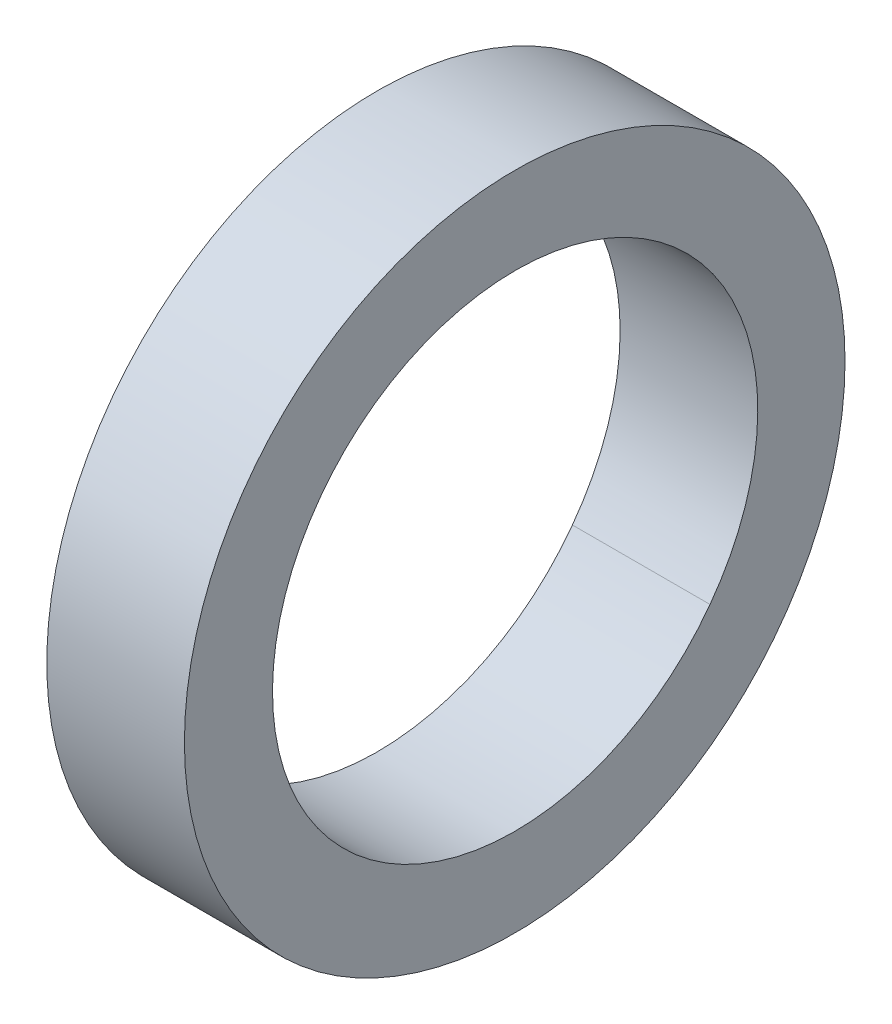
from build123d import *
from build123d.topology import SkipClean

# Parameters (mm, degrees)
SKETCH1_W           = 200
SKETCH1_H           = 200
BOSS_EXTRUDE1_DEPTH = 30
SKETCH4_W           = 175
SKETCH4_H           = 175
CUT_EXTRUDE1_DEPTH  = 30
SKETCH7_R           = 4
CUT_EXTRUDE2_DEPTH  = 210
SKETCH10_W          = 6.040230253
SKETCH10_H          = 30
BOSS_EXTRUDE2_DEPTH = 20
SKETCH11_W          = 10
SKETCH11_H          = 30
BOSS_EXTRUDE3_DEPTH = 20
CUT_EXTRUDE3_START  = -231
SKETCH12_R          = 4
CUT_EXTRUDE3_DEPTH  = 231
SKETCH13_R          = 4
CUT_EXTRUDE5_DEPTH  = 231
SKETCH14_R          = 4
CUT_EXTRUDE6_DEPTH  = 250.5
SKETCH15_R          = 30
SKETCH15_R_2        = 22
BOSS_EXTRUDE5_DEPTH = 201
SKETCH17_R          = 22
CUT_EXTRUDE7_DEPTH  = 201
SKETCH21_W          = 9.5
SKETCH21_H          = 28.855904386
BOSS_EXTRUDE6_DEPTH = 26
SKETCH22_W          = 9.5
SKETCH22_H          = 6.040230253
CUT_EXTRUDE10_DEPTH = 49
SKETCH23_W          = 10.008922512
SKETCH23_H          = 28.855904386
BOSS_EXTRUDE7_DEPTH = 21
SKETCH24_W          = 9.5
SKETCH24_H          = 1.144095614
CUT_EXTRUDE11_DEPTH = 27
SKETCH26_W          = 0.50137975
SKETCH26_H          = 20.893624798
CUT_EXTRUDE12_DEPTH = 35
SKETCH27_R          = 49.192783102
CUT_EXTRUDE13_DEPTH = 175
SKETCH28_R          = 41.209023923
CUT_EXTRUDE14_DEPTH = 175
CUT_EXTRUDE15_START = -220
CUT_EXTRUDE15_DEPTH = 220
SKETCH33_R          = 22
CUT_EXTRUDE16_DEPTH = 220
SKETCH34_W          = 15.88682826
SKETCH34_H          = 39.259510286
CUT_EXTRUDE17_DEPTH = 14
SKETCH35_R          = 61.810225576
CUT_EXTRUDE18_DEPTH = 218


# Read off the part's stored shape, not the designer's step: Cut-Extrude15
with BuildPart() as part:
    # Sketch1 → Boss-Extrude1 (new body)
    with BuildSketch(Plane(origin=(0, 0, 0), x_dir=(1, 0, 0), z_dir=(0, 1, 0))):
        Rectangle(SKETCH1_W, SKETCH1_H)
    extrude(amount=BOSS_EXTRUDE1_DEPTH)

    # Sketch4 → Cut-Extrude1 (cut)
    with BuildSketch(Plane(origin=(0, 30, 0), x_dir=(1, 0, 0), z_dir=(0, 1, 0))):
        Rectangle(SKETCH4_W, SKETCH4_H)
    extrude(amount=-CUT_EXTRUDE1_DEPTH, mode=Mode.SUBTRACT)

    # Sketch7 → Cut-Extrude2 (cut)
    with BuildSketch(Plane.ZY.offset(100)):
        with Locations((0, 15)):
            Circle(SKETCH7_R)
    extrude(amount=-CUT_EXTRUDE2_DEPTH, mode=Mode.SUBTRACT)

    # Sketch10 → Boss-Extrude2 (add)
    with BuildSketch(Plane.ZY.offset(100)):
        with Locations((-11.64671233, 15)):
            Rectangle(SKETCH10_W, SKETCH10_H)
    extrude(amount=BOSS_EXTRUDE2_DEPTH)

    # Sketch11 → Boss-Extrude3 (add)
    with BuildSketch(Plane.XY.offset(-8.626597203)):
        with Locations((-115, 15)):
            Rectangle(SKETCH11_W, SKETCH11_H)
    extrude(amount=BOSS_EXTRUDE3_DEPTH)

    # Sketch12 → Cut-Extrude3 (cut)
    with BuildSketch(Plane(origin=(100, 0, 0), x_dir=(0, 0, -1), z_dir=(1, 0, 0)).offset(CUT_EXTRUDE3_START)):
        with Locations(Location((0, 15, 0), (0, 0, 180))):
            Circle(SKETCH12_R)
    extrude(amount=CUT_EXTRUDE3_DEPTH, mode=Mode.SUBTRACT)

    # Sketch13 → Cut-Extrude5 (cut)
    with BuildSketch(Plane(origin=(0, 30, 0), x_dir=(1, 0, 0), z_dir=(0, 1, 0))):
        with Locations(Location((-93.69452155, -93.045501349, 0), (0, 0, 270))):
            Circle(SKETCH13_R)
    extrude(amount=-CUT_EXTRUDE5_DEPTH, mode=Mode.SUBTRACT)

    # Sketch14 → Cut-Extrude6 (cut)
    with BuildSketch(Plane.XY.offset(100)):
        with Locations((0, 13.614739596)):
            Circle(SKETCH14_R)
    extrude(amount=-CUT_EXTRUDE6_DEPTH, mode=Mode.SUBTRACT)

    # Sketch15 → Boss-Extrude5 (add)
    with BuildSketch(Plane(origin=(100, 0, 0), x_dir=(0, 0, -1), z_dir=(1, 0, 0))):
        with Locations((0, 15)):
            Circle(SKETCH15_R)
        with Locations((0, 15)):
            Circle(SKETCH15_R_2, mode=Mode.SUBTRACT)
    extrude(amount=-BOSS_EXTRUDE5_DEPTH)

    # Sketch17 → Cut-Extrude7 (cut)
    with BuildSketch(Plane(origin=(100, 0, 0), x_dir=(0, 0, -1), z_dir=(1, 0, 0))):
        with Locations((0.074377339, 15.100772812)):
            Circle(SKETCH17_R)
    extrude(amount=-CUT_EXTRUDE7_DEPTH, mode=Mode.SUBTRACT)


with BuildPart() as cut_extrude7_piece_1:
    # of the separate pieces the step leaves, piece 1, a body of its own (cut_extrude7_pieces)
    add(part.part.solids().sort_by_distance((-100, 0, -100))[0])



with BuildPart() as cut_extrude7_piece_2:
    # of the separate pieces the step leaves, piece 2, a body of its own (cut_extrude7_pieces)
    add(part.part.solids().sort_by_distance((-101, 0, -14.666827456))[0])

    # Sketch21 → Boss-Extrude6 (add)
    with BuildSketch(Plane(origin=(0, 0, -14.666827456), x_dir=(-1, 0, 0), z_dir=(0, 0, -1))):
        with Locations((115.25, 15.572047807)):
            Rectangle(SKETCH21_W, SKETCH21_H)
    extrude(amount=BOSS_EXTRUDE6_DEPTH)

    # Sketch22 → Cut-Extrude10 (cut)
    with BuildSketch(Plane(origin=(0, 30, 0), x_dir=(1, 0, 0), z_dir=(0, 1, 0))):
        with Locations((-105.75, 11.64671233)):
            Rectangle(SKETCH22_W, SKETCH22_H)
    extrude(amount=-CUT_EXTRUDE10_DEPTH, mode=Mode.SUBTRACT)


with BuildPart() as cut_extrude7_piece_1_1:
    add(cut_extrude7_piece_1.part)

    add(cut_extrude7_piece_2.part)  # Boss-Extrude7 merges Cut-Extrude7 piece 2
    # Sketch23 → Boss-Extrude7 (add)
    with BuildSketch(Plane(origin=(-110.5, 0, 0), x_dir=(0, 0, -1), z_dir=(1, 0, 0))):
        with Locations((35.6623662, 15.572047807)):
            Rectangle(SKETCH23_W, SKETCH23_H)
    extrude(amount=BOSS_EXTRUDE7_DEPTH)

    # Sketch24 → Cut-Extrude11 (cut)
    with BuildSketch(Plane(origin=(0, 0, -14.666827456), x_dir=(-1, 0, 0), z_dir=(0, 0, -1))):
        with Locations((115.25, 0.572047807)):
            Rectangle(SKETCH24_W, SKETCH24_H)
    extrude(amount=-CUT_EXTRUDE11_DEPTH, mode=Mode.SUBTRACT)

    # Sketch26 → Cut-Extrude12 (cut)
    with BuildSketch(Plane.XZ):
        with Locations((-110.249310125, 1.820215196)):
            Rectangle(SKETCH26_W, SKETCH26_H)
    extrude(amount=-CUT_EXTRUDE12_DEPTH, mode=Mode.SUBTRACT)

    # Sketch27 → Cut-Extrude13 (cut)
    with BuildSketch(Plane(origin=(-87.5, 0, 0), x_dir=(0, 0, -1), z_dir=(1, 0, 0))):
        with Locations((-31.916352411, 15.376133278)):
            Circle(SKETCH27_R)
    extrude(amount=CUT_EXTRUDE13_DEPTH, mode=Mode.SUBTRACT)

    # Sketch28 → Cut-Extrude14 (cut)
    with BuildSketch(Plane(origin=(-87.5, 0, 0), x_dir=(0, 0, -1), z_dir=(1, 0, 0))):
        with Locations((37.762434774, 15.494435184)):
            Circle(SKETCH28_R)
    extrude(amount=CUT_EXTRUDE14_DEPTH, mode=Mode.SUBTRACT)

    # Cut-Extrude15 outline → Cut-Extrude15 (cut)
    with SkipClean():  # the faces are left unmerged after this step: merging them gives an invalid solid
        with BuildSketch(Plane(origin=(100, 0, 0), x_dir=(0, 0, -1), z_dir=(1, 0, 0)).offset(CUT_EXTRUDE15_START)):
            with BuildLine():
                ThreePointArc((25.980762114, 30), (30, 15), (25.980762114, 0))
                Line((25.980762114, 0), (100, 0))
                Line((100, 0), (100, 30))
                Line((100, 30), (25.980762114, 30))
            make_face()
            with BuildLine():
                ThreePointArc((-25.980762114, 0), (-30, 15), (-25.980762114, 30))
                Line((-25.980762114, 30), (-100, 30))
                Line((-100, 30), (-100, 0))
                Line((-100, 0), (-25.980762114, 0))
            make_face()
        extrude(amount=CUT_EXTRUDE15_DEPTH, mode=Mode.SUBTRACT)

    # Sketch33 → Cut-Extrude16 (cut)
    with SkipClean():  # the faces are left unmerged after this step: merging them gives an invalid solid
        with BuildSketch(Plane(origin=(100, 0, 0), x_dir=(0, 0, -1), z_dir=(1, 0, 0))):
            with Locations((0, 15)):
                Circle(SKETCH33_R)
        extrude(amount=-CUT_EXTRUDE16_DEPTH, mode=Mode.SUBTRACT)

    # Sketch34 → Cut-Extrude17 (cut)
    with SkipClean():  # the faces are left unmerged after this step: merging them gives an invalid solid
        with BuildSketch(Plane.ZY.offset(120)):
            with Locations((-24.036891069, 10.370244857)):
                Rectangle(SKETCH34_W, SKETCH34_H)
        extrude(amount=-CUT_EXTRUDE17_DEPTH, mode=Mode.SUBTRACT)

    # Sketch35 → Cut-Extrude18 (cut)
    with BuildSketch(Plane.ZY.offset(-87.5)):
        with Locations((-0.860757222, 19.909168714)):
            Circle(SKETCH35_R)
    extrude(amount=CUT_EXTRUDE18_DEPTH, mode=Mode.SUBTRACT)


solid = cut_extrude7_piece_1_1.part
